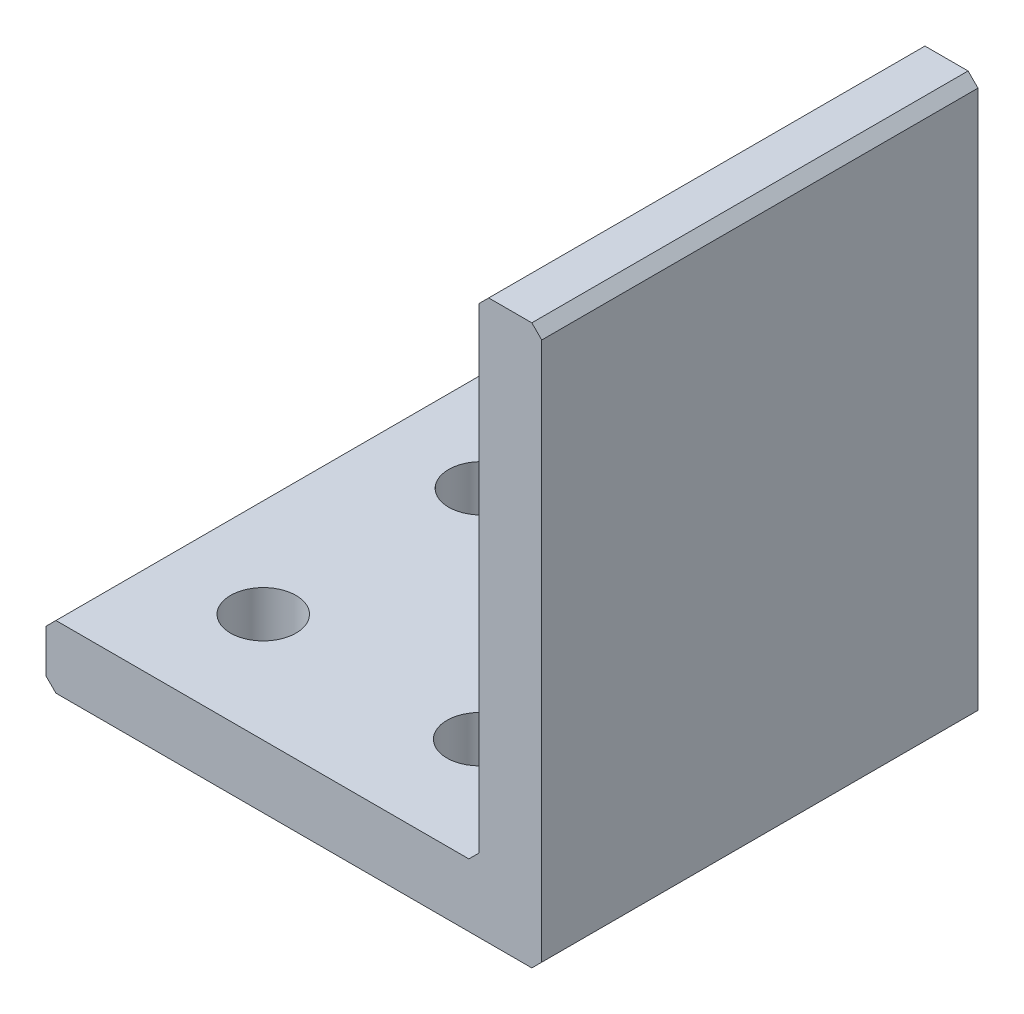
from build123d import *

# Parameters (mm, degrees)
SKETCH1_W           = 25
SKETCH1_H           = 22
BOSS_EXTRUDE1_DEPTH = 3.175
SKETCH3_W           = 3.175
SKETCH3_H           = 22
BOSS_EXTRUDE2_DEPTH = 25
SKETCH5_R           = 1.65
CUT_EXTRUDE1_DEPTH  = 31.037476592
CHAMFER1_SIZE       = 0.5


with BuildPart() as part:
    # Sketch1 → Boss-Extrude1 (new body)
    with BuildSketch(Plane(origin=(0, 0, 0), x_dir=(1, 0, 0), z_dir=(0, 1, 0))):
        Rectangle(SKETCH1_W, SKETCH1_H)
    extrude(amount=BOSS_EXTRUDE1_DEPTH)

    # Sketch3 → Boss-Extrude2 (add)
    with BuildSketch(Plane(origin=(0, 3.175, 0), x_dir=(1, 0, 0), z_dir=(0, 1, 0))):
        with Locations((10.9125, 0)):
            Rectangle(SKETCH3_W, SKETCH3_H)
    extrude(amount=BOSS_EXTRUDE2_DEPTH)

    # Sketch5 → Cut-Extrude1 (cut, through all)
    with BuildSketch(Plane(origin=(0, 3.175, 0), x_dir=(1, 0, 0), z_dir=(0, 1, 0))):
        with Locations((-7.04375, 5.5)):
            Circle(SKETCH5_R)
        with Locations((3.86875, 5.5)):
            Circle(SKETCH5_R)
        with Locations((-7.04375, -5.5)):
            Circle(SKETCH5_R)
        with Locations((3.86875, -5.5)):
            Circle(SKETCH5_R)
    extrude(amount=-CUT_EXTRUDE1_DEPTH, mode=Mode.SUBTRACT)

    # Chamfer1
    chamfer1_edges = [part.edges().sort_by_distance(p)[0] for p in [
        (-12.5, 0, 0),
        (-12.5, 3.175, 0),
        (12.5, 28.175, 0),
        (9.325, 28.175, 0),
        (12.5, 0, 0),
        (9.325, 3.175, 0),
    ]]
    chamfer(chamfer1_edges, length=CHAMFER1_SIZE)


solid = part.part
